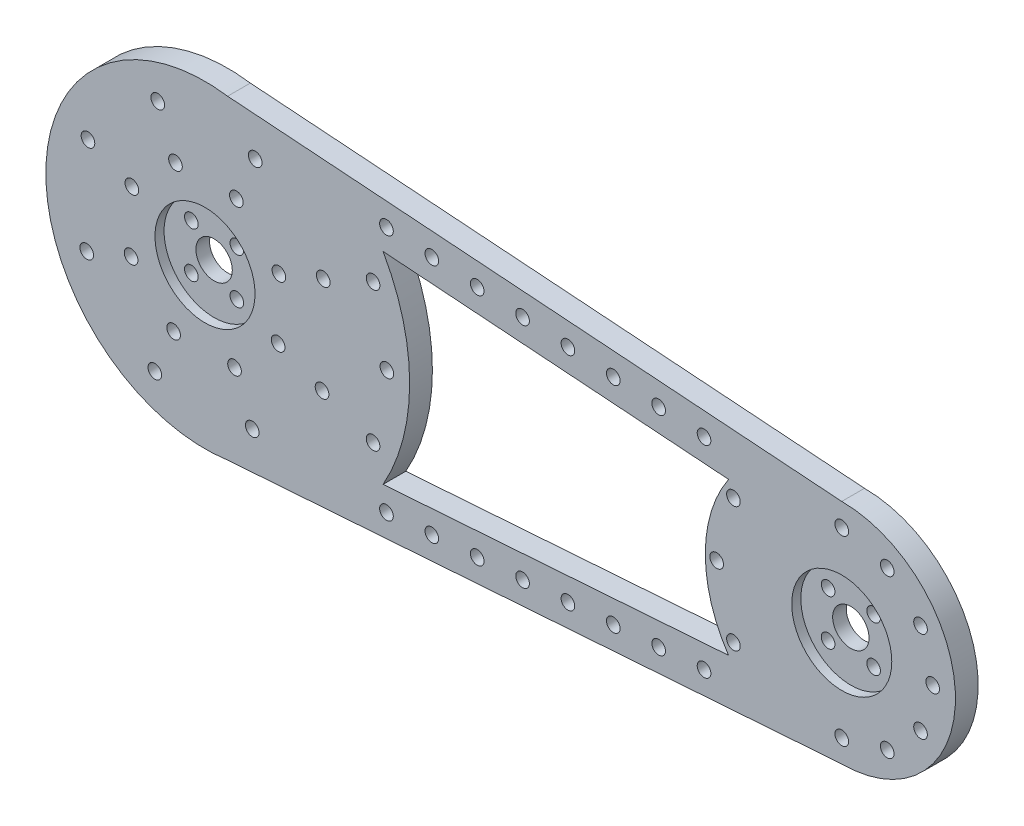
from build123d import *

# Parameters (mm, degrees)
EXTRUDE_3_DEPTH      = 5
SKETCH_4_R           = 1.5
SKETCH_4_R_2         = 4
CUT_EXTRUDE_3_DEPTH  = 5
SKETCH_5_R           = 11
CUT_EXTRUDE_4_DEPTH  = 2
SKETCH_6_R           = 1.5
CUT_EXTRUDE_6_DEPTH  = 169.745370307
SKETCH_8_R           = 1.5
CUT_EXTRUDE_8_DEPTH  = 169.745370307
SKETCH_9_R           = 1.5
EXTRUDE_4_DEPTH      = 5
SKETCH_10_R          = 1.5
EXTRUDE_6_DEPTH      = 5
SKETCH_11_R          = 11
SKETCH_11_R_2        = 1.5
EXTRUDE_12_DEPTH     = 5
SKETCH_14_R          = 1.5
CUT_EXTRUDE_9_DEPTH  = 5
EXTRUDE_START        = -5
EXTRUDE_13_DEPTH     = 5
SKETCH_16_R          = 1.5
CUT_EXTRUDE_10_DEPTH = 5
EXTRUDE_14_DEPTH     = 5
SKETCH_19_R          = 1.5
EXTRUDE_15_DEPTH     = 5
SKETCH_20_R          = 1.5
CUT_EXTRUDE_11_DEPTH = 5
EXTRUDE_16_DEPTH     = 5
SKETCH_22_R          = 1.5
EXTRUDE_17_DEPTH     = 5
SKETCH_23_R          = 1.5
CUT_EXTRUDE_15_DEPTH = 5


with BuildPart() as part:
    # 草图1 → 凸台-拉伸3 (new body)
    with BuildSketch(Plane.XY):
        with BuildLine():
            Line((140, 25), (0, 35))
            ThreePointArc((0, 35), (-35, 0), (0, -35))
            Line((0, -35), (140, -25))
            ThreePointArc((140, -25), (165, 0), (140, 25))
        make_face()
    extrude(amount=EXTRUDE_3_DEPTH)

    # 草图4 → 切除-拉伸3 (cut)
    with BuildSketch(Plane.XY.offset(5)):
        with Locations((-5, -5)):
            Circle(SKETCH_4_R)
        with Locations((5, -5)):
            Circle(SKETCH_4_R)
        with Locations((-5, 5)):
            Circle(SKETCH_4_R)
        with Locations((5, 5)):
            Circle(SKETCH_4_R)
        with Locations((135, -5)):
            Circle(SKETCH_4_R)
        with Locations((145, -5)):
            Circle(SKETCH_4_R)
        with Locations((135, 5)):
            Circle(SKETCH_4_R)
        with Locations((145, 5)):
            Circle(SKETCH_4_R)
        Circle(SKETCH_4_R_2)
        with Locations((140, 0)):
            Circle(SKETCH_4_R_2)
    extrude(amount=-CUT_EXTRUDE_3_DEPTH, mode=Mode.SUBTRACT)

    # 草图5 → 切除-拉伸4 (cut)
    with BuildSketch(Plane.XY.offset(5)):
        Circle(SKETCH_5_R)
        with Locations((140, 0)):
            Circle(SKETCH_5_R)
    extrude(amount=-CUT_EXTRUDE_4_DEPTH, mode=Mode.SUBTRACT)

    # 草图6 → 切除-拉伸6 (cut, through all)
    with BuildSketch(Plane.XY.offset(5)):
        with Locations((30, 0)):
            Circle(SKETCH_6_R)
        with Locations((25.980762114, 15)):
            Circle(SKETCH_6_R)
        with Locations((25.980762114, -15)):
            Circle(SKETCH_6_R)
        with Locations((15, 25.980762114)):
            Circle(SKETCH_6_R)
        with Locations((15, -25.980762114)):
            Circle(SKETCH_6_R)
        with Locations((0, 30)):
            Circle(SKETCH_6_R)
        with Locations((0, -30)):
            Circle(SKETCH_6_R)
        with Locations((-15, 25.980762114)):
            Circle(SKETCH_6_R)
        with Locations((-15, -25.980762114)):
            Circle(SKETCH_6_R)
        with Locations((-25.980762114, 15)):
            Circle(SKETCH_6_R)
        with Locations((-25.980762114, -15)):
            Circle(SKETCH_6_R)
        with Locations((-30, 0)):
            Circle(SKETCH_6_R)
        with Locations((160, 0)):
            Circle(SKETCH_6_R)
        with Locations((157.320508076, 10)):
            Circle(SKETCH_6_R)
        with Locations((157.320508076, -10)):
            Circle(SKETCH_6_R)
        with Locations((150, 17.320508076)):
            Circle(SKETCH_6_R)
        with Locations((150, -17.320508076)):
            Circle(SKETCH_6_R)
        with Locations((140, 20)):
            Circle(SKETCH_6_R)
        with Locations((140, -20)):
            Circle(SKETCH_6_R)
        with Locations((130, 17.320508076)):
            Circle(SKETCH_6_R)
        with Locations((130, -17.320508076)):
            Circle(SKETCH_6_R)
        with Locations((122.679491924, 10)):
            Circle(SKETCH_6_R)
        with Locations((122.679491924, -10)):
            Circle(SKETCH_6_R)
        with Locations((120, 0)):
            Circle(SKETCH_6_R)
    extrude(amount=-CUT_EXTRUDE_6_DEPTH, mode=Mode.SUBTRACT)

    # 草图8 → 切除-拉伸8 (cut, through all)
    with BuildSketch(Plane.XY.offset(5)):
        with Locations((9.974586998, -29.2875295)):
            Circle(SKETCH_8_R)
        with Locations((19.949173997, -28.575059)):
            Circle(SKETCH_8_R)
        with Locations((9.974586998, 29.2875295)):
            Circle(SKETCH_8_R)
        with BuildLine():
            ThreePointArc((26.297708958, 23.096114469), (35, 0), (26.297708958, -23.096114469))
            Line((26.297708958, -23.096114469), (121.06763386, -16.326834119))
            ThreePointArc((121.06763386, -16.326834119), (115, 0), (121.06763386, 16.326834119))
            Line((121.06763386, 16.326834119), (26.297708958, 23.096114469))
        make_face()
        with Locations((19.949173997, 28.575059)):
            Circle(SKETCH_8_R)
        with Locations((29.923760995, -27.8625885)):
            Circle(SKETCH_8_R)
        with Locations((39.898347993, -27.150118)):
            Circle(SKETCH_8_R)
        with Locations((119.69504398, -21.450354001)):
            Circle(SKETCH_8_R)
        with Locations((129.669630978, -20.737883502)):
            Circle(SKETCH_8_R)
        with Locations((29.923760995, 27.8625885)):
            Circle(SKETCH_8_R)
        with Locations((129.669630978, 20.737883502)):
            Circle(SKETCH_8_R)
        with Locations((119.69504398, 21.450354001)):
            Circle(SKETCH_8_R)
        with Locations((49.872934992, -26.437647501)):
            Circle(SKETCH_8_R)
        with Locations((109.720456981, -22.162824501)):
            Circle(SKETCH_8_R)
        with Locations((39.898347993, 27.150118)):
            Circle(SKETCH_8_R)
        with Locations((109.720456981, 22.162824501)):
            Circle(SKETCH_8_R)
        with Locations((59.84752199, -25.725177001)):
            Circle(SKETCH_8_R)
        with Locations((99.745869983, -22.875295001)):
            Circle(SKETCH_8_R)
        with Locations((49.872934992, 26.437647501)):
            Circle(SKETCH_8_R)
        with Locations((99.745869983, 22.875295001)):
            Circle(SKETCH_8_R)
        with Locations((69.822108988, -25.012706501)):
            Circle(SKETCH_8_R)
        with Locations((89.771282985, -23.587765501)):
            Circle(SKETCH_8_R)
        with Locations((59.84752199, 25.725177001)):
            Circle(SKETCH_8_R)
        with Locations((89.771282985, 23.587765501)):
            Circle(SKETCH_8_R)
        with Locations((79.796695986, -24.300236001)):
            Circle(SKETCH_8_R)
        with Locations((69.822108988, 25.012706501)):
            Circle(SKETCH_8_R)
        with Locations((79.796695986, 24.300236001)):
            Circle(SKETCH_8_R)
    extrude(amount=-CUT_EXTRUDE_8_DEPTH, mode=Mode.SUBTRACT)

    # 草图9 → 凸台-拉伸4 (add)
    with BuildSketch(Plane.XY.offset(5)):
        with Locations((15, 25.980762114)):
            Circle(SKETCH_9_R)
        with Locations((15, -25.980762114)):
            Circle(SKETCH_9_R)
    extrude(amount=-EXTRUDE_4_DEPTH)

    # 草图10 → 凸台-拉伸6 (add)
    with BuildSketch(Plane.XY.offset(5)):
        with Locations((130, -17.320508076)):
            Circle(SKETCH_10_R)
        with Locations((130, 17.320508076)):
            Circle(SKETCH_10_R)
    extrude(amount=-EXTRUDE_6_DEPTH)

    # 草图11 → 凸台-拉伸12 (add)
    # profile 1 of 7: a face of its own
    with BuildSketch(Plane.XY.offset(5)):
        with BuildLine():
            ThreePointArc((21.242995392, -27.816095103), (35, 0), (21.242995392, 27.816095103))
            ThreePointArc((21.242995392, 27.816095103), (20.807825204, 29.804985057), (18.79080718, 29.5280471))
            ThreePointArc((18.79080718, 29.5280471), (-35, 0), (18.79080718, -29.5280471))
            ThreePointArc((18.79080718, -29.5280471), (20.807825204, -29.804985057), (21.242995392, -27.816095103))
        make_face()
        Circle(SKETCH_11_R, mode=Mode.SUBTRACT)
    # profile 2 of 7: a face of its own
    with BuildSketch(Plane.XY.offset(5)):
        with Locations((119.69504398, 21.450354001)):
            Circle(SKETCH_11_R_2)
    # profile 3 of 7: a face of its own
    with BuildSketch(Plane.XY.offset(5)):
        with Locations((119.69504398, -21.450354001)):
            Circle(SKETCH_11_R_2)
    # profile 4 of 7: a face of its own
    with BuildSketch(Plane.XY.offset(5)):
        with Locations((29.923760995, -27.8625885)):
            Circle(SKETCH_11_R_2)
    # profile 5 of 7: a face of its own
    with BuildSketch(Plane.XY.offset(5)):
        with Locations((29.923760995, 27.8625885)):
            Circle(SKETCH_11_R_2)
    # profile 6 of 7: a face of its own
    with BuildSketch(Plane.XY.offset(5)):
        with Locations((129.669630978, -20.737883502)):
            Circle(SKETCH_11_R_2)
    # profile 7 of 7: a face of its own
    with BuildSketch(Plane.XY.offset(5)):
        with Locations((129.669630978, 20.737883502)):
            Circle(SKETCH_11_R_2)
    extrude(amount=-EXTRUDE_12_DEPTH)

    # 草图14 → 切除-拉伸9 (cut)
    with BuildSketch(Plane(origin=(0, 0, 0), x_dir=(-1, 0, 0), z_dir=(0, 0, -1))):
        with Locations((-11.039598696, 25.731833604)):
            Circle(SKETCH_14_R)
        with Locations((-6.899749185, 16.082396003)):
            Circle(SKETCH_14_R)
        with Locations((6.493111834, 16.250830708)):
            Circle(SKETCH_14_R)
        with Locations((10.388978935, 26.001329133)):
            Circle(SKETCH_14_R)
        with Locations((16.082396003, 6.899749185)):
            Circle(SKETCH_14_R)
        with Locations((25.731833604, 11.039598696)):
            Circle(SKETCH_14_R)
        with Locations((16.250830708, -6.493111834)):
            Circle(SKETCH_14_R)
        with Locations((26.001329133, -10.388978935)):
            Circle(SKETCH_14_R)
        with Locations((6.899749185, -16.082396003)):
            Circle(SKETCH_14_R)
        with Locations((11.039598696, -25.731833604)):
            Circle(SKETCH_14_R)
        with Locations((-6.493111834, -16.250830708)):
            Circle(SKETCH_14_R)
        with Locations((-10.388978935, -26.001329133)):
            Circle(SKETCH_14_R)
        with Locations((-16.082396003, -6.899749185)):
            Circle(SKETCH_14_R)
        with Locations((-25.731833604, -11.039598696)):
            Circle(SKETCH_14_R)
        with Locations((-16.250830708, 6.493111834)):
            Circle(SKETCH_14_R)
        with Locations((-26.001329133, 10.388978935)):
            Circle(SKETCH_14_R)
    extrude(amount=-CUT_EXTRUDE_9_DEPTH, mode=Mode.SUBTRACT)

    # 草图15 → 凸台-拉伸13 (add)
    with BuildSketch(Plane(origin=(0, 0, 0), x_dir=(-1, 0, 0), z_dir=(0, 0, -1)).offset(EXTRUDE_START)):
        with BuildLine():
            Line((-32.991302599, -22.618000638), (-26.297708958, -23.096114469))
            ThreePointArc((-26.297708958, -23.096114469), (-35, 0), (-26.297708958, 23.096114469))
            Line((-26.297708958, 23.096114469), (-32.991302599, 22.618000638))
            ThreePointArc((-32.991302599, 22.618000638), (-40, 0), (-32.991302599, -22.618000638))
        make_face()
    extrude(amount=EXTRUDE_13_DEPTH)

    # 草图16 → 切除-拉伸10 (cut)
    with BuildSketch(Plane(origin=(0, 0, 0), x_dir=(-1, 0, 0), z_dir=(0, 0, -1))):
        with Locations((-35, 0)):
            Circle(SKETCH_16_R)
        with Locations((-32.335783638, 13.393920133)):
            Circle(SKETCH_16_R)
        with Locations((-32.335783638, -13.393920133)):
            Circle(SKETCH_16_R)
    extrude(amount=-CUT_EXTRUDE_10_DEPTH, mode=Mode.SUBTRACT)

    # 草图18 → 凸台-拉伸14 (add)
    with BuildSketch(Plane.XY.offset(5)):
        with BuildLine():
            Line((39.15545217, 22.17770424), (32.991302599, 22.618000638))
            ThreePointArc((32.991302599, 22.618000638), (38.207670067, 11.83950793), (40, 0))
            ThreePointArc((40, 0), (38.207670067, -11.83950793), (32.991302599, -22.618000638))
            Line((32.991302599, -22.618000638), (39.15545217, -22.17770424))
            ThreePointArc((39.15545217, -22.17770424), (43.514338715, -11.467446366), (45, 0))
            ThreePointArc((45, 0), (43.514338715, 11.467446366), (39.15545217, 22.17770424))
        make_face()
    extrude(amount=-EXTRUDE_14_DEPTH)

    # 草图19 → 凸台-拉伸15 (add)
    with BuildSketch(Plane.XY.offset(5).offset(EXTRUDE_START)):
        with Locations((32.335783638, 13.393920133)):
            Circle(SKETCH_19_R)
        with Locations((35, 0)):
            Circle(SKETCH_19_R)
        with Locations((32.335783638, -13.393920133)):
            Circle(SKETCH_19_R)
    extrude(amount=EXTRUDE_15_DEPTH)

    # 草图20 → 切除-拉伸11 (cut)
    with BuildSketch(Plane(origin=(0, 0, 0), x_dir=(-1, 0, 0), z_dir=(0, 0, -1))):
        with Locations((-40, 0)):
            Circle(SKETCH_20_R)
        with Locations((-36.9551813, 15.307337295)):
            Circle(SKETCH_20_R)
        with Locations((-15.307337295, 36.9551813)):
            Circle(SKETCH_20_R)
        with Locations((0, 40)):
            Circle(SKETCH_20_R)
        with Locations((15.307337295, 36.9551813)):
            Circle(SKETCH_20_R)
        with Locations((28.284271247, 28.284271247)):
            Circle(SKETCH_20_R)
        with Locations((36.9551813, 15.307337295)):
            Circle(SKETCH_20_R)
        with Locations((40, 0)):
            Circle(SKETCH_20_R)
        with Locations((36.9551813, -15.307337295)):
            Circle(SKETCH_20_R)
        with Locations((28.284271247, -28.284271247)):
            Circle(SKETCH_20_R)
        with Locations((15.307337295, -36.9551813)):
            Circle(SKETCH_20_R)
        with Locations((0, -40)):
            Circle(SKETCH_20_R)
        with Locations((-15.307337295, -36.9551813)):
            Circle(SKETCH_20_R)
        with Locations((-36.9551813, -15.307337295)):
            Circle(SKETCH_20_R)
    extrude(amount=-CUT_EXTRUDE_11_DEPTH, mode=Mode.SUBTRACT)

    # 草图21 → 凸台-拉伸16 (add)
    with BuildSketch(Plane(origin=(0, 0, 0), x_dir=(-1, 0, 0), z_dir=(0, 0, -1))):
        with BuildLine():
            ThreePointArc((-121.06763386, 16.326834119), (-115, 0), (-121.06763386, -16.326834119))
            Line((-121.06763386, -16.326834119), (-115.112957921, -16.752168115))
            ThreePointArc((-115.112957921, -16.752168115), (-110, 0), (-115.112957921, 16.752168115))
            Line((-115.112957921, 16.752168115), (-121.06763386, 16.326834119))
        make_face()
    extrude(amount=-EXTRUDE_16_DEPTH)

    # 草图22 → 凸台-拉伸17 (add)
    with BuildSketch(Plane.XY.offset(5)):
        with Locations((122.679491924, 10)):
            Circle(SKETCH_22_R)
        with Locations((120, 0)):
            Circle(SKETCH_22_R)
        with Locations((122.679491924, -10)):
            Circle(SKETCH_22_R)
    extrude(amount=-EXTRUDE_17_DEPTH)

    # 草图23 → 切除-拉伸15 (cut)
    with BuildSketch(Plane.XY.offset(5)):
        with Locations((116.184301396, 13.75)):
            Circle(SKETCH_23_R)
        with Locations((116.184301396, -13.75)):
            Circle(SKETCH_23_R)
        with Locations((112.5, 0)):
            Circle(SKETCH_23_R)
    extrude(amount=-CUT_EXTRUDE_15_DEPTH, mode=Mode.SUBTRACT)


solid = part.part
